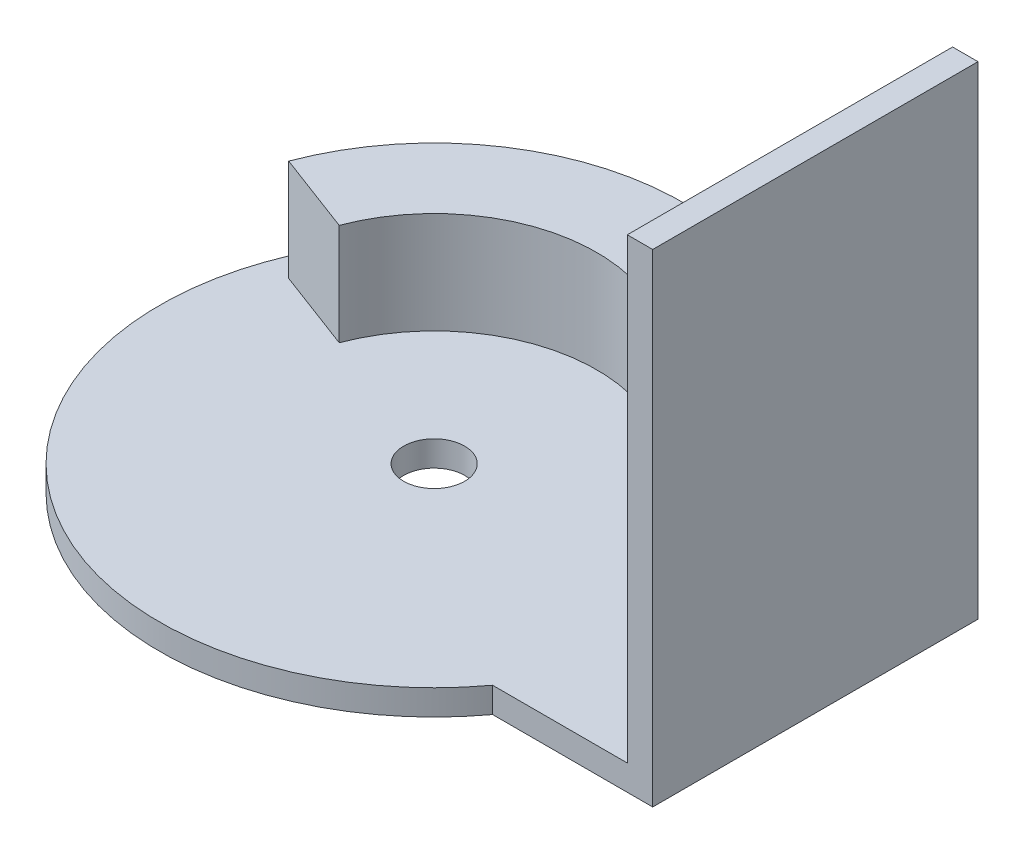
from build123d import *

# Parameters (mm, degrees)
BOSS_EXTRUDE1_DEPTH = 10
SKETCH2_R           = 3
BOSS_EXTRUDE2_DEPTH = 2.5
SKETCH4_W           = 2.5
SKETCH4_H           = 32
BOSS_EXTRUDE3_DEPTH = 45


with BuildPart() as part:
    # Sketch1 → Boss-Extrude1 (new body)
    with BuildSketch(Plane(origin=(0, 0, 0), x_dir=(1, 0, 0), z_dir=(0, 1, 0))):
        with BuildLine():
            Line((-22.931089862, 8.626419753), (-14.975405624, 5.633580247))
            ThreePointArc((-14.975405624, 5.633580247), (0, 16), (14.975405624, 5.633580247))
            Line((14.975405624, 5.633580247), (22.931089862, 8.626419753))
            ThreePointArc((22.931089862, 8.626419753), (0, 24.5), (-22.931089862, 8.626419753))
        make_face()
    extrude(amount=BOSS_EXTRUDE1_DEPTH)

    # Sketch2 → Boss-Extrude2 (add)
    with BuildSketch(Plane.XZ):
        with BuildLine():
            Line((37.5, -16), (37.5, 16))
            Line((37.5, 16), (21.748563171, 16))
            ThreePointArc((21.748563171, 16), (12.186057607, 24.093567606), (0, 27))
            ThreePointArc((0, 27), (-27, 0), (0, -27))
            ThreePointArc((0, -27), (12.186057607, -24.093567606), (21.748563171, -16))
            Line((21.748563171, -16), (37.5, -16))
        make_face()
        Circle(SKETCH2_R, mode=Mode.SUBTRACT)
    extrude(amount=BOSS_EXTRUDE2_DEPTH)

    # Sketch4 → Boss-Extrude3 (add)
    with BuildSketch(Plane(origin=(0, 0, 0), x_dir=(1, 0, 0), z_dir=(0, 1, 0))):
        with Locations((36.25, 0)):
            Rectangle(SKETCH4_W, SKETCH4_H)
    extrude(amount=BOSS_EXTRUDE3_DEPTH)


solid = part.part
